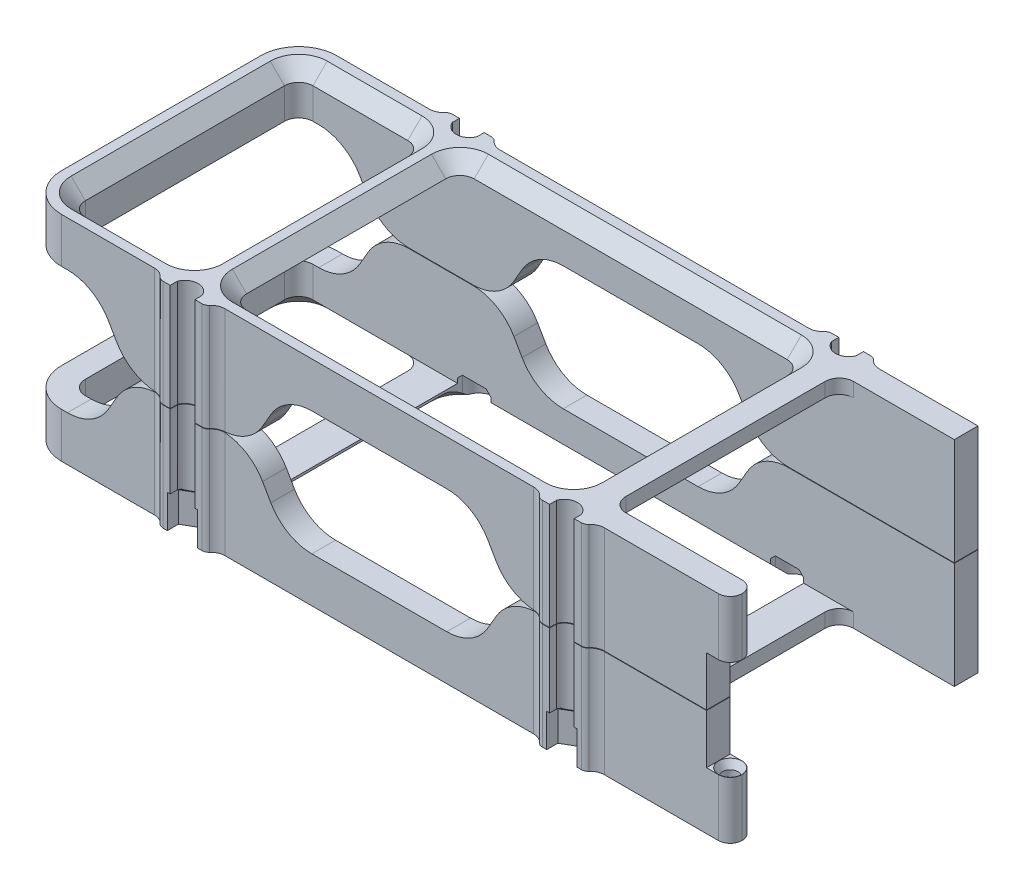
from build123d import *

# Parameters (mm, degrees)
DODANIE_WYCI_GNI_CIE1_DEPTH      = 22.5
WYTNIJ_WYCI_GNI_CIE1_DEPTH       = 86.606132958
ZAOKR_GLENIE1_R                  = 8
ZAOKR_GLENIE2_R                  = 3
ZAOKR_GLENIE3_R                  = 3
ZAOKR_GLENIE4_R                  = 2.5
DODANIE_WYCI_GNI_CIE6_DEPTH      = 3
WYTNIJ_WYCI_GNI_CIE9_DEPTH       = 99.343784755
WYTNIJ_WYCI_GNI_CIE10_DEPTH      = 99.343784755
ZAOKR_GLENIE5_R                  = 10
ZAOKR_GLENIE6_R                  = 3
SFAZOWANIE5_SIZE                 = 3
DODANIE_WYCI_GNI_CIE7_DEPTH      = 2.2
SFAZOWANIE10_SIZE                = 2.517298894
SFAZOWANIE10_SIZE_2              = 3
ZAOKR_GLENIE7_R                  = 0.2
WYTNIJ_WYCI_GNI_CIE11_DEPTH      = 7
SFAZOWANIE6_SIZE                 = 0.7
WYTNIJ_WYCI_GNI_CIE12_DEPTH      = 5
SFAZOWANIE7_SIZE                 = 1
WYTNIJ_WYCI_GNI_CIE13_DEPTH      = 20.5
WYTNIJ_WYCI_GNI_CIE13_DEPTH_BACK = 20.5
SZKIC21_R                        = 1.6
WYTNIJ_WYCI_GNI_CIE14_DEPTH      = 10.5
WYTNIJ_WYCI_GNI_CIE14_DEPTH_BACK = 10.5
SZKIC22_W                        = 5
SZKIC22_H                        = 5
SFAZOWANIE8_SIZE                 = 1.5
SFAZOWANIE8_SIZE2                = 0.866025404
SFAZOWANIE9_SIZE                 = 1.5
SFAZOWANIE9_SIZE2                = 0.866025404


# Some blends are built 0.0001 mm under size
with BuildPart() as part:
    # Szkic1 → Dodanie-wyciągnięcie1 (new body)
    with BuildSketch(Plane(origin=(0, 0, 0), x_dir=(1, 0, 0), z_dir=(0, 1, 0))):
        with BuildLine():
            Line((-70, -24), (74, -24))
            Line((74, -24), (74, -29))
            Line((74, -29), (45.6, -29))
            ThreePointArc((45.6, -29), (40, -34.6), (34.4, -29))
            Line((34.4, -29), (-34.4, -29))
            ThreePointArc((-34.4, -29), (-40, -34.6), (-45.6, -29))
            Line((-45.6, -29), (-75, -29))
            Line((-75, -29), (-75, -24))
            Line((-75, -24), (-75, 24))
            Line((-75, 24), (-75, 29))
            Line((-75, 29), (-45.6, 29))
            ThreePointArc((-45.6, 29), (-40, 34.6), (-34.4, 29))
            Line((-34.4, 29), (34.4, 29))
            ThreePointArc((34.4, 29), (40, 34.6), (45.6, 29))
            Line((45.6, 29), (68.25, 29))
            Line((68.25, 29), (68.25, 24))
            Line((68.25, 24), (-70, 24))
            Line((-70, 24), (-70, -24))
        make_face()
    extrude(amount=DODANIE_WYCI_GNI_CIE1_DEPTH)

    # Szkic2 → Wytnij-wyciągnięcie1 (cut, through all)
    with BuildSketch(Plane(origin=(0, 22.5, 0), x_dir=(1, 0, 0), z_dir=(0, 1, 0))):
        with BuildLine():
            Line((-44.1, -30.5), (-42.6, -30.5))
            Line((-42.6, -30.5), (-42.6, -29))
            ThreePointArc((-42.6, -29), (-40, -27.214322345), (-37.4, -29))
            Line((-37.4, -29), (-37.4, -30.5))
            Line((-37.4, -30.5), (-35.9, -30.5))
            ThreePointArc((-35.9, -30.5), (-34.839339828, -30.060660172), (-34.4, -29))
            ThreePointArc((-34.4, -29), (-40, -34.6), (-45.6, -29))
            ThreePointArc((-45.6, -29), (-45.160660172, -30.060660172), (-44.1, -30.5))
        make_face()
        with BuildLine():
            Line((-37.4, 30.5), (-35.9, 30.5))
            ThreePointArc((-35.9, 30.5), (-34.839339828, 30.060660172), (-34.4, 29))
            ThreePointArc((-34.4, 29), (-40, 34.6), (-45.6, 29))
            ThreePointArc((-45.6, 29), (-45.160660172, 30.060660172), (-44.1, 30.5))
            Line((-44.1, 30.5), (-42.6, 30.5))
            Line((-42.6, 30.5), (-42.6, 29))
            ThreePointArc((-42.6, 29), (-40, 27.214322345), (-37.4, 29))
            Line((-37.4, 29), (-37.4, 30.5))
        make_face()
        with BuildLine():
            Line((44.1, 30.5), (42.6, 30.5))
            Line((42.6, 30.5), (42.6, 29))
            ThreePointArc((42.6, 29), (40, 27.214322345), (37.4, 29))
            Line((37.4, 29), (37.4, 30.5))
            Line((37.4, 30.5), (35.9, 30.5))
            ThreePointArc((35.9, 30.5), (34.839339828, 30.060660172), (34.4, 29))
            ThreePointArc((34.4, 29), (40, 34.6), (45.6, 29))
            ThreePointArc((45.6, 29), (45.160660172, 30.060660172), (44.1, 30.5))
        make_face()
        with BuildLine():
            Line((37.4, -30.5), (35.9, -30.5))
            ThreePointArc((35.9, -30.5), (34.839339828, -30.060660172), (34.4, -29))
            ThreePointArc((34.4, -29), (40, -34.6), (45.6, -29))
            ThreePointArc((45.6, -29), (45.160660172, -30.060660172), (44.1, -30.5))
            Line((44.1, -30.5), (42.6, -30.5))
            Line((42.6, -30.5), (42.6, -29))
            ThreePointArc((42.6, -29), (40, -27.214322345), (37.4, -29))
            Line((37.4, -29), (37.4, -30.5))
        make_face()
    extrude(amount=-WYTNIJ_WYCI_GNI_CIE1_DEPTH, mode=Mode.SUBTRACT)

    # Zaokrąglenie1
    zaokr_glenie1_edges = [part.edges().sort_by_distance(p)[0] for p in [
        (-75, 11.25, 29),
        (-75, 11.25, -29),
    ]]
    fillet(zaokr_glenie1_edges, radius=ZAOKR_GLENIE1_R)

    # Zaokrąglenie2
    zaokr_glenie2_edges = [part.edges().sort_by_distance(p)[0] for p in [
        (-70, 11.25, -24),
        (-70, 11.25, 24),
    ]]
    fillet(zaokr_glenie2_edges, radius=ZAOKR_GLENIE2_R)

    # Zaokrąglenie3
    zaokr_glenie3_edges = [part.edges().sort_by_distance(p)[0] for p in [
        (45.6, 11.25, 29),
        (34.4, 11.25, 29),
        (-34.4, 11.25, 29),
        (-45.6, 11.25, 29),
        (-45.6, 11.25, -29),
        (-34.4, 11.25, -29),
        (34.4, 11.25, -29),
        (45.6, 11.25, -29),
    ]]
    fillet(zaokr_glenie3_edges, radius=ZAOKR_GLENIE3_R)

    # Zaokrąglenie4
    zaokr_glenie4_edges = [part.edges().sort_by_distance(p)[0] for p in [
        (74, 11.25, 24),
        (74, 11.25, 29),
    ]]
    fillet(zaokr_glenie4_edges, radius=ZAOKR_GLENIE4_R - 0.0001)  # a hair under: the kernel refuses the full size

    # Szkic16 → Dodanie-wyciągnięcie6 (add)
    with BuildSketch(Plane.XZ):
        Polygon((44, 24), (44, -24), (40, -24), (36, -24), (36, 24), align=None)
        Polygon((-44, -24), (-40, -24), (-36, -24), (-36, 24), (-44, 24), align=None)
    extrude(amount=-DODANIE_WYCI_GNI_CIE6_DEPTH)

    # Szkic17 → Wytnij-wyciągnięcie9 (cut, through all)
    with BuildSketch(Plane.XY.offset(29)):
        Polygon((-75, 9.5), (-60, 9.5), (-52.494446501, 22.5), (-75, 22.5), align=None)
    extrude(amount=-WYTNIJ_WYCI_GNI_CIE9_DEPTH, mode=Mode.SUBTRACT)

    # Szkic18 → Wytnij-wyciągnięcie10 (cut, through all)
    with BuildSketch(Plane.XY.offset(29)):
        Polygon((-27.505553499, 22.5), (-20, 9.5), (20, 9.5), (27.505553499, 22.5), align=None)
    extrude(amount=-WYTNIJ_WYCI_GNI_CIE10_DEPTH, mode=Mode.SUBTRACT)

    # Zaokrąglenie5
    zaokr_glenie5_edges = [part.edges().sort_by_distance(p)[0] for p in [
        (-52.494446501, 22.5, -26.5),
        (-52.494446501, 22.5, 26.5),
        (-27.505553499, 22.5, 26.5),
        (-20, 9.5, 26.5),
        (20, 9.5, 26.5),
        (27.505553499, 22.5, 26.5),
        (-27.505553499, 22.5, -26.5),
        (-20, 9.5, -26.5),
        (20, 9.5, -26.5),
        (27.505553499, 22.5, -26.5),
        (-60, 9.5, -26.5),
        (-60, 9.5, 26.5),
    ]]
    fillet(zaokr_glenie5_edges, radius=ZAOKR_GLENIE5_R)

    # Zaokrąglenie6
    zaokr_glenie6_edges = [part.edges().sort_by_distance(p)[0] for p in [
        (36, 1.5, -24),
        (36, 1.5, 24),
        (44, 1.5, 24),
        (44, 1.5, -24),
        (-44, 1.5, -24),
        (-44, 1.5, 24),
        (-36, 1.5, 24),
        (-36, 1.5, -24),
    ]]
    fillet(zaokr_glenie6_edges, radius=ZAOKR_GLENIE6_R)

    # Sfazowanie5
    sfazowanie5_edges = [part.edges().sort_by_distance(p)[0] for p in [
        (-44, 0, 0),
        (-44.878679656, 0, 23.121320344),
        (-44.878679656, 0, -23.121320344),
        (-57, 0, 24),
        (-57, 0, -24),
        (-69.121320344, 0, 23.121320344),
        (-69.121320344, 0, -23.121320344),
        (-70, 0, 0),
        (36, 0, 0),
        (35.121320344, 0, -23.121320344),
        (35.121320344, 0, 23.121320344),
        (0, 0, -24),
        (0, 0, 24),
        (-35.121320344, 0, -23.121320344),
        (-35.121320344, 0, 23.121320344),
        (-36, 0, 0),
    ]]
    chamfer(sfazowanie5_edges, length=SFAZOWANIE5_SIZE - 0.0001)  # a hair under: the kernel refuses the full size

    # Szkic24 → Dodanie-wyciągnięcie7 (add)
    with BuildSketch(Plane(origin=(0, 22.5, 0), x_dir=(1, 0, 0), z_dir=(0, 1, 0))):
        Polygon((68.25, 29), (65.25, 29), (65.25, 31.5), align=None)
    extrude(amount=-DODANIE_WYCI_GNI_CIE7_DEPTH)

    # Sfazowanie10
    # the kernel refuses this chamfer: 3, 2.517298894 mm, written as the material it adds along each edge
    with BuildSketch(Plane(origin=(75.98221831, 20.3, -29), x_dir=(0, -0.9993728857116145, 0.03540953691366271), z_dir=(-1, 0, 0))) as sfazowanie10_piece_1_section:
        Polygon((SFAZOWANIE10_SIZE * 0.999372885526, -SFAZOWANIE10_SIZE * 0.0354095369071), (-SFAZOWANIE10_SIZE_2 * 0.0354095369137, -SFAZOWANIE10_SIZE_2 * 0.999372885712), (0, 0), align=None)
    sfazowanie10_piece_1 = extrude(amount=10.73221831, mode=Mode.PRIVATE)
    sfazowanie10_piece_1 = split(sfazowanie10_piece_1, bisect_by=Plane(origin=(66.795397226, 19.323739852, -30.212168979), z_dir=(-0.6401843996644804, 0, 0.7682212795973754)), keep=Keep.TOP, mode=Mode.PRIVATE)
    add(sfazowanie10_piece_1)

    # Zaokrąglenie7
    zaokr_glenie7_edges = [part.edges().sort_by_distance(p)[0] for p in [
        (65.25, 21.190225092, -31.5),
    ]]
    fillet(zaokr_glenie7_edges, radius=ZAOKR_GLENIE7_R)


with BuildPart() as body_2:
    # Lustro1: mirrored copy
    add(part.part.mirror(Plane.ZX.offset(22.55)))


with BuildPart() as part_1:
    add(part.part)

    # Szkic19 → Wytnij-wyciągnięcie11 (cut)
    with BuildSketch(Plane.XZ):
        Polygon((40, -26.304958277), (36.8, -28.152479139), (36.8, -31.847520861), (40, -33.695041723), (43.2, -31.847520861), (43.2, -28.152479139), align=None)
        Polygon((-40, -26.304958277), (-43.2, -28.152479139), (-43.2, -31.847520861), (-40, -33.695041723), (-36.8, -31.847520861), (-36.8, -28.152479139), align=None)
        Polygon((-40, 26.304958277), (-36.8, 28.152479139), (-36.8, 31.847520861), (-40, 33.695041723), (-43.2, 31.847520861), (-43.2, 28.152479139), align=None)
        Polygon((40, 26.304958277), (43.2, 28.152479139), (43.2, 31.847520861), (40, 33.695041723), (36.8, 31.847520861), (36.8, 28.152479139), align=None)
    extrude(amount=-WYTNIJ_WYCI_GNI_CIE11_DEPTH, mode=Mode.SUBTRACT)

    # Sfazowanie6
    # the kernel refuses this chamfer: 0.7 mm, written as the material it adds along each edge
    with BuildSketch(Plane(origin=(35.241000041, 7, 29.052568184), x_dir=(-0.01374793830529274, -0.9996219169112968, -0.023812127644089357), z_dir=(0.8660254037844384, 0, -0.5000000000000006))) as sfazowanie6_piece_1_section:
        Polygon((SFAZOWANIE6_SIZE * 0.999621916911, -SFAZOWANIE6_SIZE * 0.0274958766106), (-SFAZOWANIE6_SIZE * 0.0274958766106, -SFAZOWANIE6_SIZE * 0.999621916911), (0, 0), align=None)
    sfazowanie6_piece_1 = extrude(amount=7.295397906, mode=Mode.PRIVATE)
    sfazowanie6_piece_1 = sfazowanie6_piece_1 - Plane(origin=(40, 6.763382755, 30), x_dir=(0.9333456062030596, 0, -0.3589790793088689), z_dir=(0, 1, 0)) * Cylinder(2.785677655, 18, mode=Mode.PRIVATE)
    add(sfazowanie6_piece_1)
    with BuildSketch(Plane(origin=(38.441000041, 7, 25.404869231), x_dir=(0.013747938305290607, -0.9996219169112968, -0.02381212764408566), z_dir=(0.8660254037844384, 0, 0.5000000000000007))) as sfazowanie6_piece_2_section:
        Polygon((SFAZOWANIE6_SIZE * 0.999621916911, -SFAZOWANIE6_SIZE * 0.0274958766106), (-SFAZOWANIE6_SIZE * 0.0274958766106, -SFAZOWANIE6_SIZE * 0.999621916911), (0, 0), align=None)
    sfazowanie6_piece_2 = extrude(amount=7.295397906, mode=Mode.PRIVATE)
    sfazowanie6_piece_2 = sfazowanie6_piece_2 - Plane(origin=(40, 6.763382755, 30), x_dir=(0.9333456062030596, 0, -0.3589790793088689), z_dir=(0, 1, 0)) * Cylinder(2.785677655, 18, mode=Mode.PRIVATE)
    add(sfazowanie6_piece_2)
    with BuildSketch(Plane(origin=(-44.758999959, 7, 29.052568184), x_dir=(-0.013747938305293077, -0.9996219169112968, -0.023812127644089926), z_dir=(0.8660254037844383, 0, -0.5000000000000008))) as sfazowanie6_piece_3_section:
        Polygon((SFAZOWANIE6_SIZE * 0.999621916911, -SFAZOWANIE6_SIZE * 0.0274958766106), (-SFAZOWANIE6_SIZE * 0.0274958766106, -SFAZOWANIE6_SIZE * 0.999621916911), (0, 0), align=None)
    sfazowanie6_piece_3 = extrude(amount=7.295397906, mode=Mode.PRIVATE)
    sfazowanie6_piece_3 = sfazowanie6_piece_3 - Plane(origin=(-40, 6.763382755, 30), x_dir=(-0.9333456062030596, 0, -0.3589790793088689), z_dir=(0, 1, 0)) * Cylinder(2.785677655, 18, mode=Mode.PRIVATE)
    add(sfazowanie6_piece_3)
    with BuildSketch(Plane(origin=(-41.558999959, 7, 25.404869231), x_dir=(0.013747938305292407, -0.9996219169112968, -0.02381212764408879), z_dir=(0.8660254037844385, 0, 0.5000000000000004))) as sfazowanie6_piece_4_section:
        Polygon((SFAZOWANIE6_SIZE * 0.999621916911, -SFAZOWANIE6_SIZE * 0.0274958766106), (-SFAZOWANIE6_SIZE * 0.0274958766106, -SFAZOWANIE6_SIZE * 0.999621916911), (0, 0), align=None)
    sfazowanie6_piece_4 = extrude(amount=7.295397906, mode=Mode.PRIVATE)
    sfazowanie6_piece_4 = sfazowanie6_piece_4 - Plane(origin=(-40, 6.763382755, 30), x_dir=(-0.9333456062030596, 0, -0.3589790793088689), z_dir=(0, 1, 0)) * Cylinder(2.785677655, 18, mode=Mode.PRIVATE)
    add(sfazowanie6_piece_4)
    with BuildSketch(Plane(origin=(-35.241000041, 7, -29.052568184), x_dir=(0.013747938305292723, -0.9996219169112968, 0.023812127644089374), z_dir=(-0.8660254037844387, 0, 0.4999999999999999))) as sfazowanie6_piece_5_section:
        Polygon((SFAZOWANIE6_SIZE * 0.999621916911, -SFAZOWANIE6_SIZE * 0.0274958766106), (-SFAZOWANIE6_SIZE * 0.0274958766106, -SFAZOWANIE6_SIZE * 0.999621916911), (0, 0), align=None)
    sfazowanie6_piece_5 = extrude(amount=7.295397906, mode=Mode.PRIVATE)
    sfazowanie6_piece_5 = sfazowanie6_piece_5 - Plane(origin=(-40, 6.763382755, -30), x_dir=(-0.9333456062030596, 0, 0.3589790793088689), z_dir=(0, 1, 0)) * Cylinder(2.785677655, 18, mode=Mode.PRIVATE)
    add(sfazowanie6_piece_5)
    with BuildSketch(Plane(origin=(-38.441000041, 7, -25.404869231), x_dir=(-0.013747938305294832, -0.9996219169112964, 0.023812127644093076), z_dir=(-0.8660254037844393, 0, -0.4999999999999991))) as sfazowanie6_piece_6_section:
        Polygon((SFAZOWANIE6_SIZE * 0.999621916911, -SFAZOWANIE6_SIZE * 0.0274958766106), (-SFAZOWANIE6_SIZE * 0.0274958766106, -SFAZOWANIE6_SIZE * 0.999621916911), (0, 0), align=None)
    sfazowanie6_piece_6 = extrude(amount=7.295397906, mode=Mode.PRIVATE)
    sfazowanie6_piece_6 = sfazowanie6_piece_6 - Plane(origin=(-40, 6.763382755, -30), x_dir=(-0.9333456062030596, 0, 0.3589790793088689), z_dir=(0, 1, 0)) * Cylinder(2.785677655, 18, mode=Mode.PRIVATE)
    add(sfazowanie6_piece_6)
    with BuildSketch(Plane(origin=(44.758999959, 7, -29.052568184), x_dir=(0.013747938305292723, -0.9996219169112968, 0.023812127644089374), z_dir=(-0.8660254037844387, 0, 0.4999999999999999))) as sfazowanie6_piece_7_section:
        Polygon((SFAZOWANIE6_SIZE * 0.999621916911, -SFAZOWANIE6_SIZE * 0.0274958766106), (-SFAZOWANIE6_SIZE * 0.0274958766106, -SFAZOWANIE6_SIZE * 0.999621916911), (0, 0), align=None)
    sfazowanie6_piece_7 = extrude(amount=7.295397906, mode=Mode.PRIVATE)
    sfazowanie6_piece_7 = sfazowanie6_piece_7 - Plane(origin=(40, 6.763382755, -30), x_dir=(0.9333456062030596, 0, 0.3589790793088689), z_dir=(0, 1, 0)) * Cylinder(2.785677655, 18, mode=Mode.PRIVATE)
    add(sfazowanie6_piece_7)
    with BuildSketch(Plane(origin=(41.558999959, 7, -25.404869231), x_dir=(-0.013747938305292721, -0.9996219169112968, 0.023812127644089374), z_dir=(-0.8660254037844388, 0, -0.49999999999999983))) as sfazowanie6_piece_8_section:
        Polygon((SFAZOWANIE6_SIZE * 0.999621916911, -SFAZOWANIE6_SIZE * 0.0274958766106), (-SFAZOWANIE6_SIZE * 0.0274958766106, -SFAZOWANIE6_SIZE * 0.999621916911), (0, 0), align=None)
    sfazowanie6_piece_8 = extrude(amount=7.295397906, mode=Mode.PRIVATE)
    sfazowanie6_piece_8 = sfazowanie6_piece_8 - Plane(origin=(40, 6.763382755, -30), x_dir=(0.9333456062030596, 0, 0.3589790793088689), z_dir=(0, 1, 0)) * Cylinder(2.785677655, 18, mode=Mode.PRIVATE)
    add(sfazowanie6_piece_8)

    # Szkic20 → Wytnij-wyciągnięcie12 (cut)
    with BuildSketch(Plane.XZ):
        with BuildLine():
            Line((36.5, 25), (36.5, -25))
            ThreePointArc((36.5, -25), (33, -28.5), (29.5, -25))
            Line((29.5, -25), (29.5, 25))
            ThreePointArc((29.5, 25), (33, 28.5), (36.5, 25))
        make_face()
        with BuildLine():
            Line((-36.5, 25), (-36.5, -25))
            ThreePointArc((-36.5, -25), (-33, -28.5), (-29.5, -25))
            Line((-29.5, -25), (-29.5, 25))
            ThreePointArc((-29.5, 25), (-33, 28.5), (-36.5, 25))
        make_face()
    extrude(amount=-WYTNIJ_WYCI_GNI_CIE12_DEPTH, mode=Mode.SUBTRACT)

    # Sfazowanie7
    sfazowanie7_edges = [part_1.edges().sort_by_distance(p)[0] for p in [
        (29.5, 5, 24.5),
        (29.5, 5, -24.5),
        (36.5, 5, 24.5),
        (36.5, 5, -24.5),
        (33, 5, 28.5),
        (33, 5, -28.5),
        (-36.5, 5, 24.5),
        (-36.5, 5, -24.5),
        (-29.5, 5, 24.5),
        (-29.5, 5, -24.5),
        (-33, 5, 28.5),
        (-33, 5, -28.5),
    ]]
    chamfer(sfazowanie7_edges, length=SFAZOWANIE7_SIZE)


with BuildPart() as wytnij_wyci_gni_cie13_tool:
    # Szkic21 → Wytnij-wyciągnięcie13 (new, two sides: drawn at the far end of the back side and taken through both)
    with BuildSketch(Plane(origin=(0, 22.55, 0), x_dir=(1, 0, 0), z_dir=(0, 1, 0)).offset(-WYTNIJ_WYCI_GNI_CIE13_DEPTH_BACK)):
        with Locations(Location((71.5, -26.5, 0), (0, 0, 90))):
            Circle(SZKIC21_R)
    extrude(amount=WYTNIJ_WYCI_GNI_CIE13_DEPTH + WYTNIJ_WYCI_GNI_CIE13_DEPTH_BACK)


with BuildPart() as part_2:
    add(part_1.part)

    # Wytnij-wyciągnięcie13: cut by wytnij_wyci_gni_cie13_tool
    add(wytnij_wyci_gni_cie13_tool.part, mode=Mode.SUBTRACT)


with BuildPart() as body_2_1:
    add(body_2.part)

    # Wytnij-wyciągnięcie13: cut by wytnij_wyci_gni_cie13_tool
    add(wytnij_wyci_gni_cie13_tool.part, mode=Mode.SUBTRACT)


with BuildPart() as wytnij_wyci_gni_cie14_tool:
    # Szkic22 → Wytnij-wyciągnięcie14 (new, two sides: drawn at the far end of the back side and taken through both)
    with BuildSketch(Plane(origin=(0, 22.55, 0), x_dir=(1, 0, 0), z_dir=(0, 1, 0)).offset(-WYTNIJ_WYCI_GNI_CIE14_DEPTH_BACK)):
        with Locations((71.5, -26.5)):
            Rectangle(SZKIC22_W, SZKIC22_H)
    extrude(amount=WYTNIJ_WYCI_GNI_CIE14_DEPTH + WYTNIJ_WYCI_GNI_CIE14_DEPTH_BACK)


with BuildPart() as part_3:
    add(part_2.part)

    # Wytnij-wyciągnięcie14: cut by wytnij_wyci_gni_cie14_tool
    add(wytnij_wyci_gni_cie14_tool.part, mode=Mode.SUBTRACT)

    # Sfazowanie8
    sfazowanie8_edges = [part_3.edges().sort_by_distance(p)[0] for p in [
        (71.5, 12.05, 28.1),
    ]]
    sfazowanie8_side = [part_3.faces().sort_by_distance(p)[0] for p in [
        (71.5, 7.05, 28.1),
    ]]
    chamfer(sfazowanie8_edges, length=SFAZOWANIE8_SIZE, length2=SFAZOWANIE8_SIZE2, reference=sfazowanie8_side[0])


with BuildPart() as body_2_2:
    add(body_2_1.part)

    # Wytnij-wyciągnięcie14: cut by wytnij_wyci_gni_cie14_tool
    add(wytnij_wyci_gni_cie14_tool.part, mode=Mode.SUBTRACT)

    # Sfazowanie9
    sfazowanie9_edges = [body_2_2.edges().sort_by_distance(p)[0] for p in [
        (71.5, 33.05, 28.1),
    ]]
    sfazowanie9_side = [body_2_2.faces().sort_by_distance(p)[0] for p in [
        (71.5, 38.05, 28.1),
    ]]
    chamfer(sfazowanie9_edges, length=SFAZOWANIE9_SIZE, length2=SFAZOWANIE9_SIZE2, reference=sfazowanie9_side[0])


solid = Compound([part_3.part, body_2_2.part])
